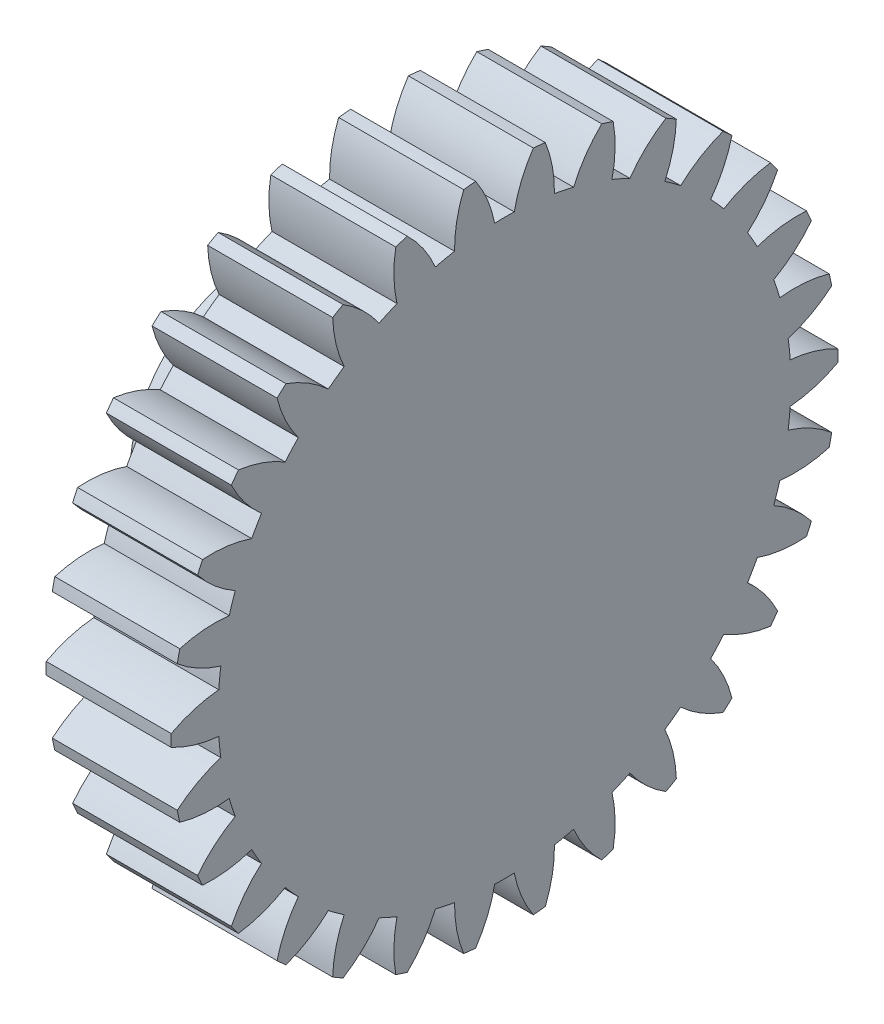
from build123d import *

# Parameters (mm, degrees)
BASPROSKE_W         = 12.7
BASPROSKE_H         = 33.866666667
TOOTHCUT_DEPTH      = 50.549896289
TEETHCUTS_COUNT     = 30
TEETHCUTS_ANGLE     = 348
SKETCH1_R           = 12.7
SKETCH1_R_2         = 4.953
BOSS_EXTRUDE2_DEPTH = 12.7
SKETCH3_R           = 3.302
CUT_EXTRUDE1_DEPTH  = 50.463042002
CUT_EXTRUDE2_DEPTH  = 8.255


with BuildPart() as part:
    # BasProSke → Base-Revolve (revolve)
    with BuildSketch(Plane(origin=(0, 0, 0), x_dir=(1, 0, 0), z_dir=(0, 1, 0))):
        with Locations((6.35, 16.933333334)):
            Rectangle(BASPROSKE_W, BASPROSKE_H)
    revolve(axis=Axis((-10, 0, 0), (1, 0, 0)))

    # TooCutSke → ToothCut (cut, through all)
    with BuildSketch(Plane(origin=(0, 0, 0), x_dir=(0, 0, -1), z_dir=(1, 0, 0))):
        with BuildLine():
            ThreePointArc((0.995262134, 29.085873679), (0, 29.102896667), (-0.995262134, 29.085873679))
            ThreePointArc((-0.995262134, 29.085873679), (-1.736289099, 31.523168017), (-2.948832865, 33.763539028))
            ThreePointArc((-2.948832865, 33.763539028), (0, 33.892066667), (2.948832865, 33.763539028))
            ThreePointArc((2.948832865, 33.763539028), (1.736289099, 31.523168017), (0.995262134, 29.085873679))
        make_face()
    toothcut = extrude(amount=TOOTHCUT_DEPTH, mode=Mode.SUBTRACT)

    # TeethCuts: ToothCut ×30 about axis
    teethcuts_axis = Axis((-10, 0, 0), (1, 0, 0))
    for i in range(1, TEETHCUTS_COUNT):
        add(toothcut.rotate(teethcuts_axis, i * TEETHCUTS_ANGLE / (TEETHCUTS_COUNT - 1)), mode=Mode.SUBTRACT)

    # Sketch1 → Boss-Extrude2 (add)
    with BuildSketch(Plane.ZY):
        Circle(SKETCH1_R)
        Circle(SKETCH1_R_2, mode=Mode.SUBTRACT)
    extrude(amount=BOSS_EXTRUDE2_DEPTH)

    # Sketch3 → Cut-Extrude1 (cut, through all)
    with BuildSketch(Plane(origin=(0, 0, 0), x_dir=(1, 0, 0), z_dir=(0, 1, 0))):
        with Locations((-6.35, 0)):
            Circle(SKETCH3_R)
    extrude(amount=CUT_EXTRUDE1_DEPTH, mode=Mode.SUBTRACT)

    # Sketch4 → Cut-Extrude2 (cut)
    with BuildSketch(Plane(origin=(0, 0, 0), x_dir=(1, 0, 0), z_dir=(0, 1, 0))):
        Polygon((-3.527045859, 4.8895), (-9.172954141, 4.8895), (-11.995908282, 0), (-9.172954141, -4.8895), (-3.527045859, -4.8895), (-0.704091718, 0), align=None)
    extrude(amount=CUT_EXTRUDE2_DEPTH, mode=Mode.SUBTRACT)


solid = part.part
